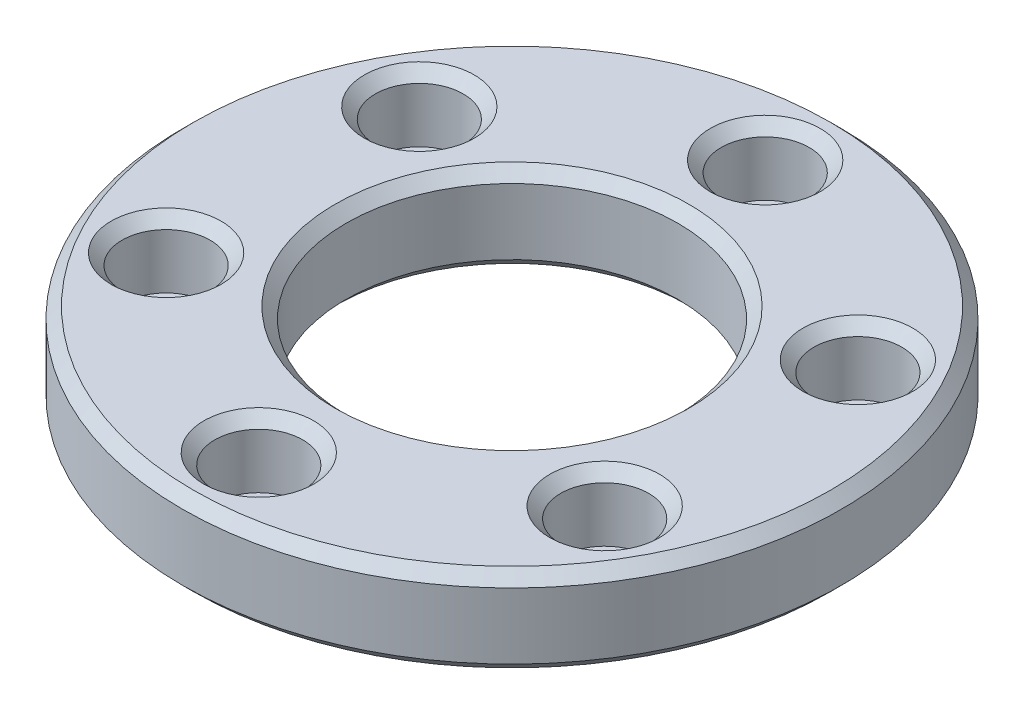
from build123d import *

# Parameters (mm, degrees)
SKETCH_1_R      = 15
SKETCH_1_R_2    = 7.55
SKETCH_1_R_3    = 2
EXTRUDE_1_DEPTH = 3
EXTRUDE_START   = 1
SKETCH_2_R      = 15
SKETCH_2_R_2    = 7.55
EXTRUDE_2_DEPTH = 1
CHAMFER_1_SIZE  = 0.5


with BuildPart() as part:
    # 草图1 → 凸台-拉伸1 (new body)
    with BuildSketch(Plane(origin=(0, 0, 0), x_dir=(1, 0, 0), z_dir=(0, 1, 0))):
        Circle(SKETCH_1_R)
        Circle(SKETCH_1_R_2, mode=Mode.SUBTRACT)
        with Locations((0, 11.525)):
            Circle(SKETCH_1_R_3, mode=Mode.SUBTRACT)
        with Locations((9.980942779, 5.7625)):
            Circle(SKETCH_1_R_3, mode=Mode.SUBTRACT)
        with Locations((9.980942779, -5.7625)):
            Circle(SKETCH_1_R_3, mode=Mode.SUBTRACT)
        with Locations((0, -11.525)):
            Circle(SKETCH_1_R_3, mode=Mode.SUBTRACT)
        with Locations((-9.980942779, -5.7625)):
            Circle(SKETCH_1_R_3, mode=Mode.SUBTRACT)
        with Locations((-9.980942779, 5.7625)):
            Circle(SKETCH_1_R_3, mode=Mode.SUBTRACT)
    extrude(amount=EXTRUDE_1_DEPTH)

    # 草图2 → 凸台-拉伸2 (add)
    with BuildSketch(Plane(origin=(0, 0, 0), x_dir=(-1, 0, 0), z_dir=(0, -1, 0)).offset(EXTRUDE_START)):
        Circle(SKETCH_2_R)
        Circle(SKETCH_2_R_2, mode=Mode.SUBTRACT)
    extrude(amount=-EXTRUDE_2_DEPTH)

    # 倒角1
    chamfer_1_edges = [part.edges().sort_by_distance(p)[0] for p in [
        (7.55, -1, 0),
        (15, -1, 0),
        (-11.980942779, 3, -5.7625),
        (-2, 3, 11.525),
        (7.980942779, 3, -5.7625),
        (-7.55, 3, 0),
        (-15, 3, 0),
        (-2, 3, -11.525),
        (7.980942779, 3, 5.7625),
        (-11.980942779, 3, 5.7625),
    ]]
    chamfer(chamfer_1_edges, length=CHAMFER_1_SIZE)


solid = part.part
